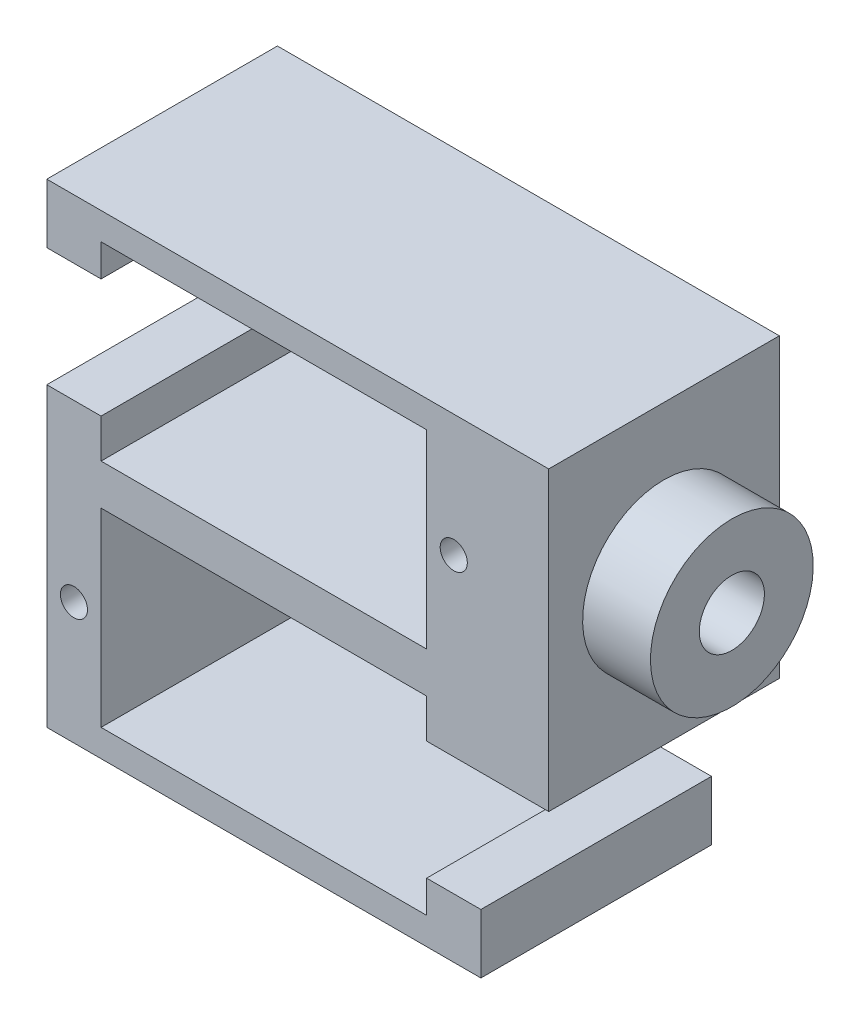
from build123d import *

# Parameters (mm, degrees)
SKETCH2_W               = 32.000000477
SKETCH2_H               = 35
SKETCH2_W_2             = 22
SKETCH2_H_2             = 5
BOSS_EXTRUDE1_DEPTH     = 35
SKETCH3_W               = 15
SKETCH3_H               = 35
CUT_EXTRUDE1_DEPTH      = 90.56534365
CUT_EXTRUDE2_REACH      = 91.565
SKETCH4_W               = 20
SKETCH4_H               = 8.75
CUT_EXTRUDE3_REACH      = 91.565
SKETCH5_W               = 20
SKETCH5_H               = 8.75
SKETCH6_W               = 3
SKETCH6_H               = 35
CUT_EXTRUDE4_DEPTH      = 90.56534365
SKETCH11_R              = 1
CUT_EXTRUDE5_DEPTH      = 10
CUT_EXTRUDE6_DEPTH      = 80.508206961
CUT_EXTRUDE6_DEPTH_BACK = 17
CUT_EXTRUDE9_START      = -17
CUT_EXTRUDE9_DEPTH      = 17
SKETCH7_W               = 17
SKETCH7_H               = 21.875
BOSS_EXTRUDE2_DEPTH     = 5
SKETCH14_R              = 6
SKETCH14_R_2            = 2.4
BOSS_EXTRUDE6_DEPTH     = 5
CUT_EXTRUDE10_REACH     = 92.366
SKETCH15_R              = 1
SKETCH16_R              = 2
CUT_EXTRUDE11_DEPTH     = 7.000000238


# Read off the part's stored shape, not the designer's step: Cut-Extrude9
with BuildPart() as part:
    # Sketch2 → Boss-Extrude1 (new body)
    # profile 1 of 2: a face of its own
    with BuildSketch(Plane.XY):
        with Locations((0.112238017, 58.479936513)):
            Rectangle(SKETCH2_W, SKETCH2_H)
        Polygon((-10.887761984, 72.979936603), (-10.887761984, 43.979936513), (11.112238016, 43.979936513), (11.112238016, 72.979936513), align=None, mode=Mode.SUBTRACT)
    # profile 2 of 2: a face of its own
    with BuildSketch(Plane.XY):
        with Locations((0.112238016, 58.479936513)):
            Rectangle(SKETCH2_W_2, SKETCH2_H_2)
    extrude(amount=-BOSS_EXTRUDE1_DEPTH)

    # Sketch3 → Cut-Extrude1 (cut, through all)
    with BuildSketch(Plane(origin=(16.112238255, 0, 0), x_dir=(0, 0, -1), z_dir=(1, 0, 0))):
        with Locations((7.5, 58.479936513)):
            Rectangle(SKETCH3_W, SKETCH3_H)
    extrude(amount=-CUT_EXTRUDE1_DEPTH, mode=Mode.SUBTRACT)

    # Sketch4 → Cut-Extrude2 (cut, up to next)
    with BuildSketch(Plane.ZY.offset(15.887762222), mode=Mode.PRIVATE) as cut_extrude2_sk1:
        with Locations((-25, 67.229936513)):
            Rectangle(SKETCH4_W, SKETCH4_H)
    cut_extrude2_tool1 = extrude(cut_extrude2_sk1.sketch, amount=-CUT_EXTRUDE2_REACH, mode=Mode.PRIVATE) & part.part
    add(cut_extrude2_tool1.solids().sort_by_distance((-15.887762, 67.229937, -25))[0], mode=Mode.SUBTRACT)

    # Sketch5 → Cut-Extrude3 (cut, up to next)
    with BuildSketch(Plane(origin=(16.112238255, 0, 0), x_dir=(0, 0, -1), z_dir=(1, 0, 0)), mode=Mode.PRIVATE) as cut_extrude3_sk1:
        with Locations((25, 49.729936513)):
            Rectangle(SKETCH5_W, SKETCH5_H)
    cut_extrude3_tool1 = extrude(cut_extrude3_sk1.sketch, amount=-CUT_EXTRUDE3_REACH, mode=Mode.PRIVATE) & part.part
    add(cut_extrude3_tool1.solids().sort_by_distance((16.112238, 49.729937, -25))[0], mode=Mode.SUBTRACT)

    # Sketch6 → Cut-Extrude4 (cut, through all)
    with BuildSketch(Plane.ZY.offset(15.887762222)):
        with Locations((-33.5, 58.479936513)):
            Rectangle(SKETCH6_W, SKETCH6_H)
    extrude(amount=-CUT_EXTRUDE4_DEPTH, mode=Mode.SUBTRACT)

    # Sketch11 → Cut-Extrude5 (cut)
    with BuildSketch(Plane.XY.offset(-15)):
        with Locations((14.112238016, 66.979936513)):
            Circle(SKETCH11_R)
        with Locations((-13.887761984, 49.979936513)):
            Circle(SKETCH11_R)
    extrude(amount=-CUT_EXTRUDE5_DEPTH, mode=Mode.SUBTRACT)

    # Sketch12 → Cut-Extrude6 (cut, two sides: drawn at the far end of the back side and taken through both)
    with BuildSketch(Plane.XY.offset(-15).offset(-CUT_EXTRUDE6_DEPTH_BACK)):
        Polygon((-10.887761984, 62.854936513), (-11.887761984, 62.854936513), (-11.887761984, 59.979936513), (12.112238016, 59.979936513), (12.112238016, 73.979936509), (-11.887761984, 73.979936607), (-11.887761984, 71.604936513), (-10.887761984, 71.604936513), (-10.887761984, 72.979936603), (11.112238016, 72.979936513), (11.112238016, 60.979936513), (-10.887761984, 60.979936513), align=None)
    extrude(amount=CUT_EXTRUDE6_DEPTH + CUT_EXTRUDE6_DEPTH_BACK, mode=Mode.SUBTRACT)

    # Cut-Extrude9 outline → Cut-Extrude9 (cut)
    with BuildSketch(Plane.XY.offset(-15).offset(CUT_EXTRUDE9_START)):
        Polygon((12.112238016, 56.979936513), (-11.887761984, 56.979936513), (-11.887761984, 42.979936513), (12.112238016, 42.979936513), (12.112238016, 45.354936513), (11.112238016, 45.354936513), (11.112238016, 43.979936513), (-10.887761984, 43.979936513), (-10.887761984, 55.979936513), (11.112238016, 55.979936513), (11.112238016, 54.104936513), (12.112238016, 54.104936513), align=None)
    extrude(amount=CUT_EXTRUDE9_DEPTH, mode=Mode.SUBTRACT)

    # Sketch7 → Boss-Extrude2 (add)
    with BuildSketch(Plane(origin=(16.112238255, 0, 0), x_dir=(0, 0, -1), z_dir=(1, 0, 0))):
        with Locations((23.5, 65.042436513)):
            Rectangle(SKETCH7_W, SKETCH7_H)
    extrude(amount=BOSS_EXTRUDE2_DEPTH)

    # Sketch14 → Boss-Extrude6 (add)
    with BuildSketch(Plane(origin=(21.112238255, 0, 0), x_dir=(0, 0, -1), z_dir=(1, 0, 0))):
        with Locations(Location((23.5, 65.042436513, 0), (0, 0, 90))):
            Circle(SKETCH14_R)
        with Locations(Location((23.5, 65.042436513, 0), (0, 0, 90))):
            Circle(SKETCH14_R_2, mode=Mode.SUBTRACT)
    extrude(amount=BOSS_EXTRUDE6_DEPTH)

    # Sketch15 → Cut-Extrude10 (cut, up to next)
    with BuildSketch(Plane(origin=(21.112238255, 0, 0), x_dir=(0, 0, -1), z_dir=(1, 0, 0)), mode=Mode.PRIVATE) as cut_extrude10_sk1:
        with Locations(Location((23.5, 65.042436513, 0), (0, 0, 90))):
            Circle(SKETCH15_R)
    cut_extrude10_tool1 = extrude(cut_extrude10_sk1.sketch, amount=-CUT_EXTRUDE10_REACH, mode=Mode.PRIVATE) & part.part
    add(cut_extrude10_tool1.solids().sort_by_distance((21.112238, 65.042437, -23.5))[0], mode=Mode.SUBTRACT)

    # Sketch16 → Cut-Extrude11 (cut)
    with BuildSketch(Plane.ZY.offset(-12.112238016)):
        with Locations((-23.5, 65.042436513)):
            Circle(SKETCH16_R)
    extrude(amount=-CUT_EXTRUDE11_DEPTH, mode=Mode.SUBTRACT)


solid = part.part
